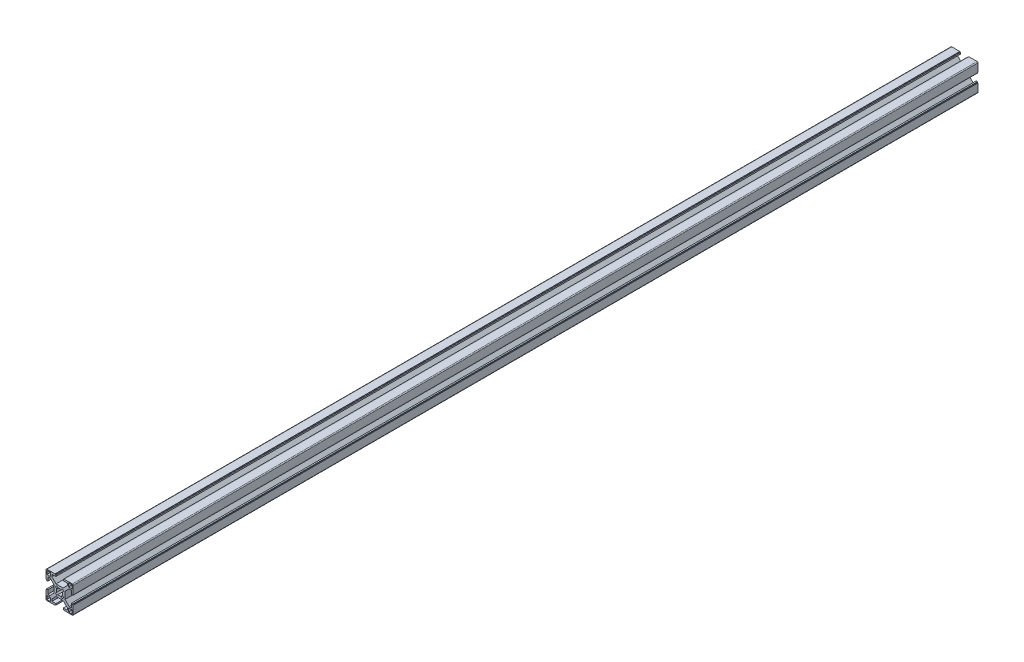
from build123d import *

# Parameters (mm, degrees)
ESBO_O1_W                = 4
ESBO_O1_H                = 4
RESSALTO_EXTRUS_O1_DEPTH = 1000
PADR_OCIRCULAR1_COUNT    = 4
FILETE1_R                = 1


with BuildPart() as part:
    # Esboço1 → Ressalto-extrusão1 (new body)
    with BuildSketch(Plane.XY):
        with BuildLine():
            ThreePointArc((-1.664601464, 3.078815026), (-0.858529967, 3.393070335), (0, 3.5))
            Line((0, 3.5), (0, 6))
            Line((0, 6), (-3.878679656, 6))
            Line((-3.878679656, 6), (-8.5, 10.621320344))
            Line((-8.5, 10.621320344), (-8.5, 13))
            Line((-8.5, 13), (-4.1, 13))
            Line((-4.1, 13), (-4.1, 14.5))
            Line((-4.1, 14.5), (-5.1, 14.5))
            Line((-5.1, 14.5), (-5.1, 15))
            Line((-5.1, 15), (-15, 15))
            Line((-15, 15), (-15, 5.1))
            Line((-15, 5.1), (-14.5, 5.1))
            Line((-14.5, 5.1), (-14.5, 4.1))
            Line((-14.5, 4.1), (-13, 4.1))
            Line((-13, 4.1), (-13, 8.5))
            Line((-13, 8.5), (-10.621320344, 8.5))
            Line((-10.621320344, 8.5), (-6, 3.878679656))
            Line((-6, 3.878679656), (-6, 0))
            Line((-6, 0), (-3.5, 0))
            ThreePointArc((-3.5, 0), (-3.393070335, 0.858529967), (-3.078815026, 1.664601464))
            Line((-3.078815026, 1.664601464), (-4.596194078, 3.181980515))
            Line((-4.596194078, 3.181980515), (-3.181980515, 4.596194078))
            Line((-3.181980515, 4.596194078), (-1.664601464, 3.078815026))
        make_face()
        with Locations((-12, 12)):
            Rectangle(ESBO_O1_W, ESBO_O1_H, mode=Mode.SUBTRACT)
    ressalto_extrus_o1 = extrude(amount=RESSALTO_EXTRUS_O1_DEPTH)

    # PadrãoCircular1: Ressalto-extrusão1 ×4 about axis
    padr_ocircular1_axis = Axis((0, 0, 0), (0, 0, 1))
    for i in range(1, PADR_OCIRCULAR1_COUNT):
        add(ressalto_extrus_o1.rotate(padr_ocircular1_axis, i * 360 / PADR_OCIRCULAR1_COUNT))

    # Filete1
    filete1_edges = [part.edges().sort_by_distance(p)[0] for p in [
        (15, 15, 500),
        (-15, 15, 500),
        (-15, -15, 500),
        (15, -15, 500),
    ]]
    fillet(filete1_edges, radius=FILETE1_R)


solid = part.part
